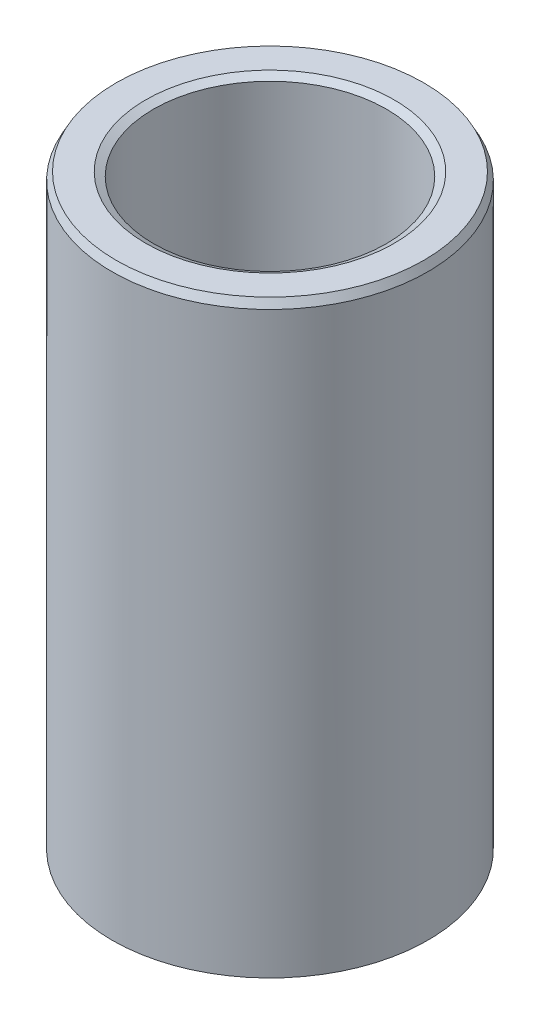
from build123d import *
from OCP.BRepFilletAPI import BRepFilletAPI_MakeChamfer

# Parameters (mm, degrees)
SKETCH1_R           = 32.5
BOSS_EXTRUDE1_DEPTH = 121.567854391
SKETCH2_R           = 23.973101143
CUT_EXTRUDE1_DEPTH  = 130.966315718
CHAMFER1_SIZE       = 1.598849275
CHAMFER1_SIZE2      = 0.857617364


with BuildPart() as part:
    # Sketch1 → Boss-Extrude1 (new body)
    with BuildSketch(Plane(origin=(0, 0, 0), x_dir=(1, 0, 0), z_dir=(0, 1, 0))):
        Circle(SKETCH1_R)
    extrude(amount=BOSS_EXTRUDE1_DEPTH)

    # Sketch2 → Cut-Extrude1 (cut, through all)
    with BuildSketch(Plane(origin=(0, 0, 0), x_dir=(1, 0, 0), z_dir=(0, 1, 0))):
        Circle(SKETCH2_R)
    extrude(amount=CUT_EXTRUDE1_DEPTH, mode=Mode.SUBTRACT)

    # Chamfer1: one chamfer whose edges measure the first distance from different faces: ONE call of the kernel's chamfer builder (chamfer() names one face for all edges)
    chamfer1_edges_1 = [part.edges().sort_by_distance(p)[0] for p in [
        (-23.973101143, 121.567854391, 0),
    ]]
    chamfer1_side_1 = [part.faces().sort_by_distance(p)[0] for p in [
        (-31.580761184, 121.567854391, 0),
    ]]
    chamfer1_edges_2 = [part.edges().sort_by_distance(p)[0] for p in [
        (-23.973101143, 0, 0),
    ]]
    chamfer1_side_2 = [part.faces().sort_by_distance(p)[0] for p in [
        (-23.973101143, 60.783927196, 0),
    ]]
    chamfer1_edges_3 = [part.edges().sort_by_distance(p)[0] for p in [
        (-32.5, 0, 0),
    ]]
    chamfer1_side_3 = [part.faces().sort_by_distance(p)[0] for p in [
        (-31.580761184, 0, 0),
    ]]
    chamfer1_edges_4 = [part.edges().sort_by_distance(p)[0] for p in [
        (-32.5, 121.567854391, 0),
    ]]
    chamfer1_side_4 = [part.faces().sort_by_distance(p)[0] for p in [
        (-32.5, 60.783927196, 0),
    ]]
    chamfer1 = BRepFilletAPI_MakeChamfer(part.part.solid().wrapped)
    for e in chamfer1_edges_1:
        chamfer1.Add(CHAMFER1_SIZE, CHAMFER1_SIZE2, e.wrapped, chamfer1_side_1[0].wrapped)  # the first distance lies on this face
    for e in chamfer1_edges_2:
        chamfer1.Add(CHAMFER1_SIZE, CHAMFER1_SIZE2, e.wrapped, chamfer1_side_2[0].wrapped)  # the first distance lies on this face
    for e in chamfer1_edges_3:
        chamfer1.Add(CHAMFER1_SIZE, CHAMFER1_SIZE2, e.wrapped, chamfer1_side_3[0].wrapped)  # the first distance lies on this face
    for e in chamfer1_edges_4:
        chamfer1.Add(CHAMFER1_SIZE, CHAMFER1_SIZE2, e.wrapped, chamfer1_side_4[0].wrapped)  # the first distance lies on this face
    add(Compound.cast(chamfer1.Shape()), mode=Mode.REPLACE)


solid = part.part
